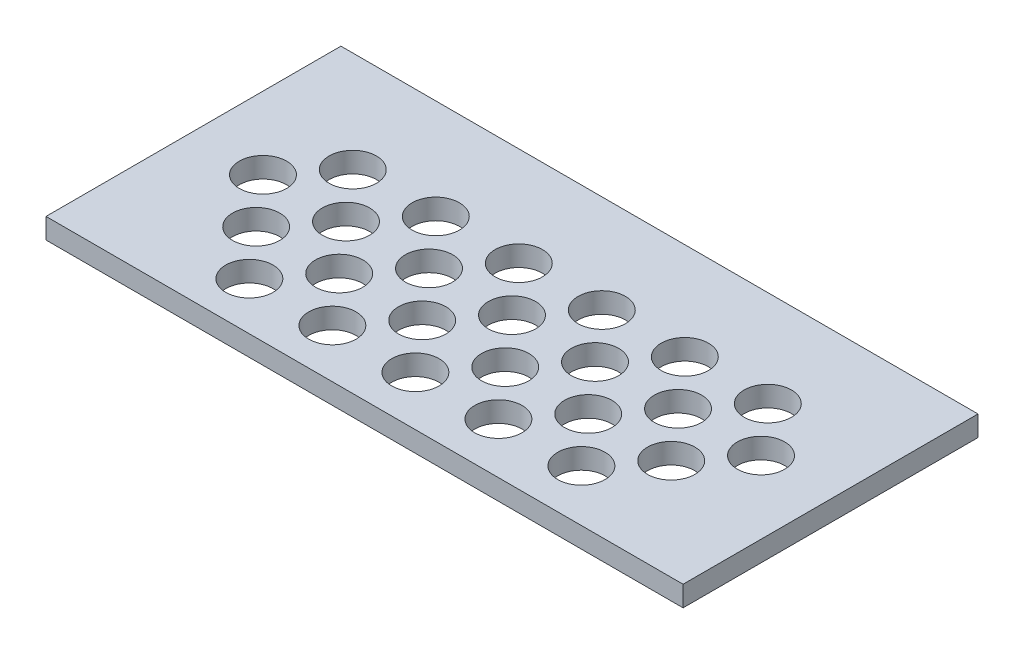
from build123d import *

# Parameters (mm, degrees)
SKETCH1_W               = 311.094159216
SKETCH1_H               = 144.015986956
BOSS_EXTRUDE1_DEPTH     = 10
SKETCH2_R               = 11.561372413
CUT_EXTRUDE1_DEPTH      = 10
FILL_PATTERN1_OUTLINE_R = 11.561372413
FILL_PATTERN1_DEPTH     = 10


# Read off the part's stored shape, not the designer's step: Fill Pattern1
with BuildPart() as part:
    # Sketch1 → Boss-Extrude1 (new body)
    with BuildSketch(Plane(origin=(0, 0, 0), x_dir=(1, 0, 0), z_dir=(0, 1, 0))):
        Rectangle(SKETCH1_W, SKETCH1_H)
    extrude(amount=BOSS_EXTRUDE1_DEPTH)

    # Sketch2 → Cut-Extrude1 (cut)
    with BuildSketch(Plane(origin=(0, 10, 0), x_dir=(1, 0, 0), z_dir=(0, 1, 0))):
        with Locations(Location((0, 0, 0), (0, 0, 270))):
            Circle(SKETCH2_R)
    extrude(amount=-CUT_EXTRUDE1_DEPTH, mode=Mode.SUBTRACT)

    # Fill Pattern1 outline → Fill Pattern1 (cut)
    with BuildSketch(Plane(origin=(0, 0, 0), x_dir=(1, 0, 0), z_dir=(0, 1, 0))):
        with Locations((-120.173715992, -1.428513712)):
            Circle(FILL_PATTERN1_OUTLINE_R)
        with Locations((80.683289444, -46.786810115)):
            Circle(FILL_PATTERN1_OUTLINE_R)
        with Locations((99.861023935, 25.060004388)):
            Circle(FILL_PATTERN1_OUTLINE_R)
        with Locations((80.115810661, 0.952342474)):
            Circle(FILL_PATTERN1_OUTLINE_R)
        with Locations((60.370597387, -23.155319439)):
            Circle(FILL_PATTERN1_OUTLINE_R)
        with Locations((100.428502718, -22.679148202)):
            Circle(FILL_PATTERN1_OUTLINE_R)
        with Locations((120.173715992, 1.428513712)):
            Circle(FILL_PATTERN1_OUTLINE_R)
        with Locations((-20.312692057, 23.631490676)):
            Circle(FILL_PATTERN1_OUTLINE_R)
        with Locations((-40.057905331, -0.476171237)):
            Circle(FILL_PATTERN1_OUTLINE_R)
        with Locations((-59.803118605, -24.583833151)):
            Circle(FILL_PATTERN1_OUTLINE_R)
        with Locations((-79.548331879, -48.691495064)):
            Circle(FILL_PATTERN1_OUTLINE_R)
        with Locations((-100.428502718, 22.679148202)):
            Circle(FILL_PATTERN1_OUTLINE_R)
        with Locations((-99.861023935, -25.060004388)):
            Circle(FILL_PATTERN1_OUTLINE_R)
        with Locations((-80.115810661, -0.952342474)):
            Circle(FILL_PATTERN1_OUTLINE_R)
        with Locations((-60.370597387, 23.155319439)):
            Circle(FILL_PATTERN1_OUTLINE_R)
        with Locations((20.312692057, -23.631490676)):
            Circle(FILL_PATTERN1_OUTLINE_R)
        with Locations((40.057905331, 0.476171237)):
            Circle(FILL_PATTERN1_OUTLINE_R)
        with Locations((59.803118605, 24.583833151)):
            Circle(FILL_PATTERN1_OUTLINE_R)
        with Locations((40.625384113, -47.262981352)):
            Circle(FILL_PATTERN1_OUTLINE_R)
        with Locations((-39.490426548, -48.215323827)):
            Circle(FILL_PATTERN1_OUTLINE_R)
        with Locations((-19.745213274, -24.107661913)):
            Circle(FILL_PATTERN1_OUTLINE_R)
        with Locations((19.745213274, 24.107661913)):
            Circle(FILL_PATTERN1_OUTLINE_R)
        with Locations((0.567478783, -47.73915259)):
            Circle(FILL_PATTERN1_OUTLINE_R)
    extrude(amount=FILL_PATTERN1_DEPTH, mode=Mode.SUBTRACT)


solid = part.part
